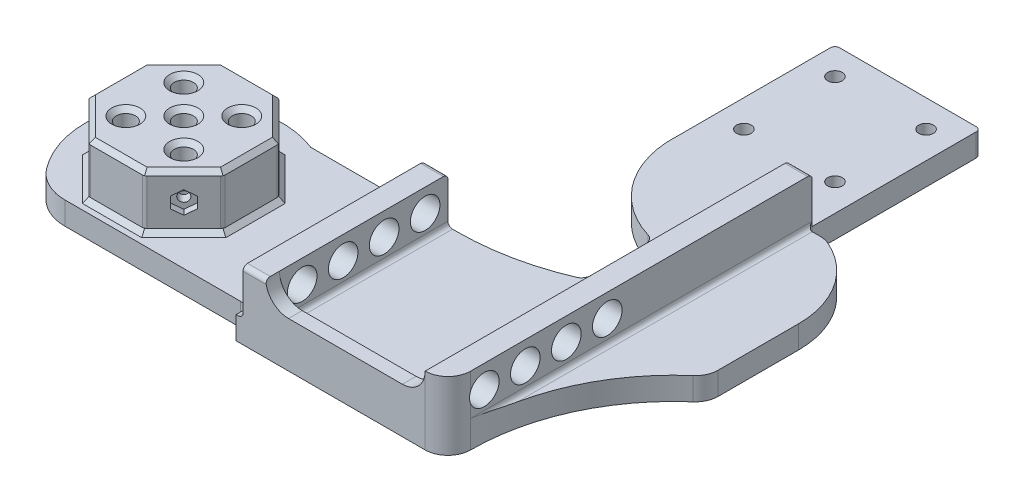
from build123d import *
from build123d.topology import SkipClean

# Parameters (mm, degrees)
SKETCH_2_W                = 32
SKETCH_2_H                = 88
EXTRUDE_1_DEPTH           = 5
SKETCH_9_W                = 100
SKETCH_9_H                = 40
EXTRUDE_6_DEPTH           = 5
SKETCH_11_R               = 2.1
CUT_EXTRUDE_3_DEPTH       = 5
SKETCH_12_R               = 21.5
SKETCH_12_R_2             = 19.5
EXTRUDE_7_DEPTH           = 8
SKETCH_13_R               = 1.6
CUT_EXTRUDE_4_DEPTH       = 112.968745639
SKETCH1_W                 = 32
SKETCH1_H                 = 5
CUT_EXTRUDE1_DEPTH        = 1
CUT_EXTRUDE_5_DEPTH       = 111.711336366
EXTRUDE_START             = 5
EXTRUDE_8_DEPTH           = 5
SKETCH_16_W               = 5
SKETCH_16_H               = 40
SKETCH_16_H_2             = 80
EXTRUDE_9_DEPTH           = 10
SKETCH_17_W               = 35
SKETCH_17_H               = 3
EXTRUDE_10_DEPTH          = 5
SKETCH_18_R               = 3.25
CUT_EXTRUDE_6_DEPTH       = 107.462434689
FILLET_5_R                = 1
FILLET_6_R                = 5
FILLET_7_R                = 1
FILLET_8_R                = 1
CUT_EXTRUDE_START         = -8
SKETCH_20_R               = 21.5
CUT_EXTRUDE_8_DEPTH       = 8
CUT_EXTRUDE_9_DEPTH       = 111.56785248
FILLET_9_R                = 10
SKETCH_22_W               = 40
SKETCH_22_H               = 5
CUT_EXTRUDE_10_DEPTH      = 17
SKETCH_23_W               = 40
SKETCH_23_H               = 5
EXTRUDE_11_DEPTH          = 17
EXTRUDE_12_DEPTH          = 5
FILLET_10_R               = 2
CUT_EXTRUDE_11_DEPTH      = 111.56785248
EXTRUDE_13_DEPTH          = 5
FILLET_12_R               = 5
FILLET_START              = -42.2945
FILLET_13_DEPTH           = 60
FILLET_START_2            = -50.0000001
FILLET_13_2_DEPTH         = 7.7055001
FILLET_START_3            = 17.7055
FILLET_13_3_DEPTH         = 7.2945
FILLET_START_4            = 5
FILLET_13_4_DEPTH         = 2
SKETCH_28_R               = 3.25
CUT_EXTRUDE_12_DEPTH      = 5
FILLET_14_R               = 5
SKETCH_29_W               = 5
SKETCH_29_H               = 8
CUT_EXTRUDE_13_DEPTH      = 1
FILLET_15_R               = 1
FILLET_16_R               = 5
EXTRUDE_START_2           = 12
SKETCH_33_R               = 2.1
EXTRUDE_15_DEPTH          = 12
CUT_EXTRUDE_15_REACH      = 102.944
CUT_EXTRUDE_15_END_RADIUS = 2.1
SKETCH_37_R               = 1.1
CUT_EXTRUDE_16_DEPTH      = 1.6
CUT_EXTRUDE_17_REACH      = 155.836
CUT_EXTRUDE_17_END_RADIUS = 2.1
SKETCH_39_R               = 1.1
CUT_EXTRUDE_18_DEPTH      = 1.6
CUT_EXTRUDE_19_REACH      = 143.078
CUT_EXTRUDE_19_END_RADIUS = 2.1
SKETCH_42_R               = 1.1
CUT_EXTRUDE_20_DEPTH      = 1.6
CUT_EXTRUDE_21_REACH      = 100.564
CUT_EXTRUDE_21_END_RADIUS = 2.1
SKETCH_44_R               = 1.1
CUT_EXTRUDE_22_DEPTH      = 1.6
CUT_EXTRUDE_23_REACH      = 127.122
CUT_EXTRUDE_23_END_RADIUS = 2.1
SKETCH_46_R               = 1.1
CUT_EXTRUDE_24_DEPTH      = 1.6
CHAMFER_1_SIZE            = 1
CHAMFER_2_SIZE            = 1
FILLET_17_R               = 1


with BuildPart() as part:
    # Эскиз2 → Бобышка-Вытянуть1 (new body)
    with BuildSketch(Plane(origin=(0, 0, 0), x_dir=(1, 0, 0), z_dir=(0, 1, 0))):
        with Locations((16, 44)):
            Rectangle(SKETCH_2_W, SKETCH_2_H)
    extrude(amount=EXTRUDE_1_DEPTH)

    # Эскиз9 → Бобышка-Вытянуть6 (add)
    with BuildSketch(Plane(origin=(0, 5, 0), x_dir=(1, 0, 0), z_dir=(0, 1, 0))):
        with Locations((-18, -10)):
            Rectangle(SKETCH_9_W, SKETCH_9_H)
    extrude(amount=-EXTRUDE_6_DEPTH)

    # Эскиз11 → Вырез-Вытянуть3 (cut)
    with BuildSketch(Plane(origin=(0, 5, 0), x_dir=(1, 0, 0), z_dir=(0, 1, 0))):
        with Locations(Location((-52.363961031, -3.636038969, 0), (0, 0, 270))):
            Circle(SKETCH_11_R)
        with Locations(Location((-39.636038969, -3.636038969, 0), (0, 0, 270))):
            Circle(SKETCH_11_R)
        with Locations(Location((-39.636038969, -16.363961031, 0), (0, 0, 270))):
            Circle(SKETCH_11_R)
        with Locations(Location((-52.363961031, -16.363961031, 0), (0, 0, 270))):
            Circle(SKETCH_11_R)
        with Locations(Location((-46, -10, 0), (0, 0, 270))):
            Circle(SKETCH_11_R)
    extrude(amount=-CUT_EXTRUDE_3_DEPTH, mode=Mode.SUBTRACT)

    # Эскиз12 → Бобышка-Вытянуть7 (add)
    with BuildSketch(Plane.XZ):
        with Locations(Location((-46, 10, 0), (0, 0, 68.471095594))):
            Circle(SKETCH_12_R)
        with Locations(Location((-46, 10, 0), (0, 0, 270))):
            Circle(SKETCH_12_R_2, mode=Mode.SUBTRACT)
    extrude(amount=EXTRUDE_7_DEPTH)

    # Эскиз13 → Вырез-Вытянуть4 (cut, through all)
    with BuildSketch(Plane(origin=(0, 5, 0), x_dir=(1, 0, 0), z_dir=(0, 1, 0))):
        with Locations(Location((6, 81, 0), (0, 0, 270))):
            Circle(SKETCH_13_R)
        with Locations(Location((6, 61, 0), (0, 0, 270))):
            Circle(SKETCH_13_R)
        with Locations(Location((26, 61, 0), (0, 0, 270))):
            Circle(SKETCH_13_R)
        with Locations(Location((26, 81, 0), (0, 0, 270))):
            Circle(SKETCH_13_R)
    extrude(amount=-CUT_EXTRUDE_4_DEPTH, mode=Mode.SUBTRACT)

    # Sketch1 → Cut-Extrude1 (cut)
    with BuildSketch(Plane(origin=(0, 0, -88), x_dir=(-1, 0, 0), z_dir=(0, 0, -1))):
        with Locations((-16, 2.5)):
            Rectangle(SKETCH1_W, SKETCH1_H)
    extrude(amount=-CUT_EXTRUDE1_DEPTH, mode=Mode.SUBTRACT)

    # Эскиз14 → Вырез-Вытянуть5 (cut, through all)
    with BuildSketch(Plane.XZ):
        with BuildLine():
            Line((-53.889866919, 30), (-68, 30))
            Line((-68, 30), (-68, -10))
            Line((-68, -10), (-53.889866919, -10))
            ThreePointArc((-53.889866919, -10), (-67.5, 10), (-53.889866919, 30))
        make_face()
    extrude(amount=-CUT_EXTRUDE_5_DEPTH, mode=Mode.SUBTRACT)

    # Эскиз15 → Бобышка-Вытянуть8 (add)
    with SkipClean():  # the faces are left unmerged after this step: merging them gives an invalid solid
        with BuildSketch(Plane(origin=(0, 0, 0), x_dir=(1, 0, 0), z_dir=(0, 1, 0)).offset(EXTRUDE_START)):
            with BuildLine():
                Line((-38.110133081, -30), (-53.889866919, -30))
                ThreePointArc((-53.889866919, -30), (-46, -31.5), (-38.110133081, -30))
            make_face()
            with BuildLine():
                Line((-53.889866919, 10), (-38.110133081, 10))
                ThreePointArc((-38.110133081, 10), (-46, 11.5), (-53.889866919, 10))
            make_face()
        extrude(amount=-EXTRUDE_8_DEPTH)

    # Эскиз16 → Бобышка-Вытянуть9 (add)
    with SkipClean():  # the faces are left unmerged after this step: merging them gives an invalid solid
        with BuildSketch(Plane(origin=(0, 5, 0), x_dir=(1, 0, 0), z_dir=(0, 1, 0))):
            with Locations((-10.5, -10)):
                Rectangle(SKETCH_16_W, SKETCH_16_H)
            with Locations((29.5, 10)):
                Rectangle(SKETCH_16_W, SKETCH_16_H_2)
        extrude(amount=EXTRUDE_9_DEPTH)

    # Эскиз17 → Бобышка-Вытянуть10 (add)
    with SkipClean():  # the faces are left unmerged after this step: merging them gives an invalid solid
        with BuildSketch(Plane(origin=(0, 5, 0), x_dir=(1, 0, 0), z_dir=(0, 1, 0))):
            with Locations((9.5, -28.5)):
                Rectangle(SKETCH_17_W, SKETCH_17_H)
        extrude(amount=EXTRUDE_10_DEPTH)

    # Эскиз18 → Вырез-Вытянуть6 (cut, through all)
    with SkipClean():  # the faces are left unmerged after this step: merging them gives an invalid solid
        with BuildSketch(Plane(origin=(-8, 0, 0), x_dir=(0, 0, -1), z_dir=(1, 0, 0))):
            with Locations((5, 10)):
                Circle(SKETCH_18_R)
            with Locations((-4, 10)):
                Circle(SKETCH_18_R)
            with Locations((-13, 10)):
                Circle(SKETCH_18_R)
            with Locations((-22, 10)):
                Circle(SKETCH_18_R)
        extrude(amount=-CUT_EXTRUDE_6_DEPTH, mode=Mode.SUBTRACT)

    # Скругление5
    fillet_5_edges = [part.edges().sort_by_distance(p)[0] for p in [
        (-13, 5, 10),
        (27, 5, -11.5),
        (9.5, 5, 27),
        (-8, 5, 8.5),
    ]]
    fillet(fillet_5_edges, radius=FILLET_5_R)

    # Скругление6
    fillet_6_edges = [part.edges().sort_by_distance(p)[0] for p in [
        (27, 10, 28.5),
        (-8, 10, 28.5),
    ]]
    fillet(fillet_6_edges, radius=FILLET_6_R - 0.0001)  # a hair under: the kernel refuses the full size

    # Скругление7
    fillet_7_edges = [part.edges().sort_by_distance(p)[0] for p in [
        (32, 2.5, -87),
        (0, 2.5, -87),
    ]]
    fillet(fillet_7_edges, radius=FILLET_7_R)

    # Скругление8
    fillet_8_edges = [part.edges().sort_by_distance(p)[0] for p in [
        (-10.5, 15, 30),
        (-10.5, 15, -10),
        (29.5, 15, -50),
    ]]
    fillet(fillet_8_edges, radius=FILLET_8_R)

    # Эскиз20 → Вырез-Вытянуть8 (cut)
    with BuildSketch(Plane.XZ.offset(8).offset(CUT_EXTRUDE_START)):
        with Locations((-46, 10)):
            Circle(SKETCH_20_R)
    extrude(amount=CUT_EXTRUDE_8_DEPTH, mode=Mode.SUBTRACT)

    # Эскиз21 → Вырез-Вытянуть9 (cut, through all)
    with BuildSketch(Plane(origin=(0, 5, 0), x_dir=(1, 0, 0), z_dir=(0, 1, 0))):
        with BuildLine():
            Line((-59.162446581, -27), (-16.5, -27))
            ThreePointArc((-16.5, -27), (-15.085786438, -27.585786438), (-14.5, -29))
            Line((-14.5, -29), (-14.5, -30))
            Line((-14.5, -30), (-38.110133081, -30))
            ThreePointArc((-38.110133081, -30), (-49.033154146, -31.284970658), (-59.162446581, -27))
        make_face()
    extrude(amount=-CUT_EXTRUDE_9_DEPTH, mode=Mode.SUBTRACT)

    # Скругление9
    fillet_9_edges = [part.edges().sort_by_distance(p)[0] for p in [
        (-59.162446581, 2.5, 27),
    ]]
    fillet(fillet_9_edges, radius=FILLET_9_R)

    # Эскиз22 → Вырез-Вытянуть10 (cut)
    with BuildSketch(Plane.ZY):
        with Locations((-30, 2.5)):
            Rectangle(SKETCH_22_W, SKETCH_22_H)
    extrude(amount=-CUT_EXTRUDE_10_DEPTH, mode=Mode.SUBTRACT)

    # Эскиз23 → Бобышка-Вытянуть11 (add)
    with BuildSketch(Plane(origin=(32, 0, 0), x_dir=(0, 0, -1), z_dir=(1, 0, 0))):
        with Locations((30, 2.5)):
            Rectangle(SKETCH_23_W, SKETCH_23_H)
    extrude(amount=EXTRUDE_11_DEPTH)

    # Эскиз25 → Бобышка-Вытянуть12 (add)
    with BuildSketch(Plane(origin=(0, 5, 0), x_dir=(1, 0, 0), z_dir=(0, 1, 0))):
        with BuildLine():
            Line((17, 15), (17, 10))
            Line((17, 10), (-6, 10))
            ThreePointArc((-6, 10), (5.768602296, 11.264429439), (17, 15))
        make_face()
        with BuildLine():
            Line((17, 30), (17, 50))
            Line((17, 50), (0, 50))
            ThreePointArc((0, 50), (5.190473587, 37.186902549), (17, 30))
        make_face()
    extrude(amount=-EXTRUDE_12_DEPTH)

    # Скругление10
    fillet_10_edges = [part.edges().sort_by_distance(p)[0] for p in [
        (17, 2.5, -15),
        (17, 2.5, -30),
    ]]
    fillet(fillet_10_edges, radius=FILLET_10_R)

    # Эскиз26 → Вырез-Вытянуть11 (cut, through all)
    with BuildSketch(Plane(origin=(0, 5, 0), x_dir=(1, 0, 0), z_dir=(0, 1, 0))):
        with BuildLine():
            Line((49, 50), (32, 50))
            ThreePointArc((32, 50), (44.175770292, 43.124404748), (49, 30))
            Line((49, 30), (49, 50))
        make_face()
    extrude(amount=-CUT_EXTRUDE_11_DEPTH, mode=Mode.SUBTRACT)

    # Эскиз27 → Бобышка-Вытянуть13 (add)
    with BuildSketch(Plane(origin=(0, 5, 0), x_dir=(1, 0, 0), z_dir=(0, 1, 0))):
        with BuildLine():
            Line((49, 10), (32, 10))
            Line((32, 10), (32, -25))
            ThreePointArc((32, -25), (36.474842586, -5.544923542), (49, 10))
        make_face()
    extrude(amount=-EXTRUDE_13_DEPTH)

    # Скругление12
    fillet_12_edges = [part.edges().sort_by_distance(p)[0] for p in [
        (32, 7.5, 30),
    ]]
    fillet(fillet_12_edges, radius=FILLET_12_R - 0.0001)  # a hair under: the kernel refuses the full size

    # Скругление13: read off the stored shape, not the designer's step
    # Скругление13 outline → Скругление13 (add)
    with BuildSketch(Plane.XY.offset(FILLET_START)):
        with BuildLine():
            Line((32, 5), (33, 5))
            ThreePointArc((33, 5), (32.292893219, 5.292893219), (32, 6))
            Line((32, 6), (32, 5))
        make_face()
    extrude(amount=FILLET_13_DEPTH)

    # Fillet 13 2 outline → Fillet 13 2 (add)
    with BuildSketch(Plane.XY.offset(FILLET_START_2)):
        with BuildLine():
            Line((32, 5), (33, 5))
            ThreePointArc((33, 5), (32.292893219, 5.292893219), (32, 6))
            Line((32, 6), (32, 5))
        make_face()
    extrude(amount=FILLET_13_2_DEPTH)

    # Fillet 13 3 outline → Fillet 13 3 (add)
    with BuildSketch(Plane.XY.offset(FILLET_START_3)):
        with BuildLine():
            Line((32, 5), (33, 5))
            ThreePointArc((33, 5), (32.292893219, 5.292893219), (32, 6))
            Line((32, 6), (32, 5))
        make_face()
    extrude(amount=FILLET_13_3_DEPTH)

    # Fillet 13 4 outline → Fillet 13 4 (cut)
    with BuildSketch(Plane(origin=(0, 0, 0), x_dir=(1, 0, 0), z_dir=(0, 1, 0)).offset(FILLET_START_4)):
        with BuildLine():
            Line((33, 50.0000001), (32, 50))
            ThreePointArc((32, 50), (32.501187488, 49.91171393), (33, 49.810870456))
            Line((33, 49.810870456), (33, 50.0000001))
        make_face()
        with BuildLine():
            Line((32, -25), (33, -25))
            Line((33, -25), (33, -15.616033699))
            ThreePointArc((33, -15.616033699), (32.250705751, -20.281450871), (32, -25))
        make_face()
    extrude(amount=FILLET_13_4_DEPTH, mode=Mode.SUBTRACT)

    # Эскиз28 → Вырез-Вытянуть12 (cut)
    with BuildSketch(Plane(origin=(32, 0, 0), x_dir=(0, 0, -1), z_dir=(1, 0, 0))):
        with Locations((5, 10)):
            Circle(SKETCH_28_R)
        with Locations((-4, 10)):
            Circle(SKETCH_28_R)
        with Locations((-13, 10)):
            Circle(SKETCH_28_R)
        with Locations((-22, 10)):
            Circle(SKETCH_28_R)
    extrude(amount=-CUT_EXTRUDE_12_DEPTH, mode=Mode.SUBTRACT)

    # Скругление14
    fillet_14_edges = [part.edges().sort_by_distance(p)[0] for p in [
        (49, 2.5, -10),
    ]]
    fillet(fillet_14_edges, radius=FILLET_14_R)

    # Эскиз29 → Вырез-Вытянуть13 (cut)
    with BuildSketch(Plane(origin=(0, 0, -50), x_dir=(-1, 0, 0), z_dir=(0, 0, -1))):
        with Locations((-34.5, 4)):
            Rectangle(SKETCH_29_W, SKETCH_29_H)
    extrude(amount=-CUT_EXTRUDE_13_DEPTH, mode=Mode.SUBTRACT)

    # Скругление15
    fillet_15_edges = [part.edges().sort_by_distance(p)[0] for p in [
        (32, 3, -49),
    ]]
    fillet(fillet_15_edges, radius=FILLET_15_R - 0.0001)  # a hair under: the kernel refuses the full size

    # Скругление16
    fillet_16_edges = [part.edges().sort_by_distance(p)[0] for p in [
        (35.782158988, 2.5, -49),
    ]]
    fillet(fillet_16_edges, radius=FILLET_16_R)

    # Эскиз33 → Бобышка-Вытянуть15 (add)
    with BuildSketch(Plane(origin=(0, 5, 0), x_dir=(1, 0, 0), z_dir=(0, 1, 0)).offset(EXTRUDE_START_2)):
        Polygon((-52.109650045, -24.75), (-39.890349955, -24.75), (-31.25, -16.109650045), (-31.25, -3.890349955), (-39.890349955, 4.75), (-52.109650045, 4.75), (-60.75, -3.890349955), (-60.75, -16.109650045), align=None)
        with Locations(Location((-52.363961031, -3.636038969, 0), (0, 0, 270))):
            Circle(SKETCH_33_R, mode=Mode.SUBTRACT)
        with Locations(Location((-46, -10, 0), (0, 0, 270))):
            Circle(SKETCH_33_R, mode=Mode.SUBTRACT)
        with Locations(Location((-52.363961031, -16.363961031, 0), (0, 0, 270))):
            Circle(SKETCH_33_R, mode=Mode.SUBTRACT)
        with Locations(Location((-39.636038969, -3.636038969, 0), (0, 0, 270))):
            Circle(SKETCH_33_R, mode=Mode.SUBTRACT)
        with Locations(Location((-39.636038969, -16.363961031, 0), (0, 0, 270))):
            Circle(SKETCH_33_R, mode=Mode.SUBTRACT)
    extrude(amount=-EXTRUDE_15_DEPTH)

    # Вырез-Вытянуть15: up to this cylinder (the profile starts outside it)
    cut_extrude_15_end = Plane(origin=(-39.636038969, 11, 16.363961031), z_dir=(0, 1, 0)) * Cylinder(CUT_EXTRUDE_15_END_RADIUS, 211.088, mode=Mode.PRIVATE)
    # Эскиз37 → Вырез-Вытянуть15 (cut, up to the surface)
    with BuildSketch(Plane(origin=(-7.570174977, 0, -7.570174977), x_dir=(0.7071067811865475, 0, -0.7071067811865477), z_dir=(0.7071067811865477, 0, 0.7071067811865475)), mode=Mode.PRIVATE) as cut_extrude_15_sk1:
        with Locations((-39.597979746, 11)):
            Circle(SKETCH_37_R)
    cut_extrude_15_tool1 = extrude(cut_extrude_15_sk1.sketch, amount=-CUT_EXTRUDE_15_REACH, mode=Mode.PRIVATE) - cut_extrude_15_end
    add(cut_extrude_15_tool1.solids().sort_by_distance((-35.570175, 11, 20.429825))[0], mode=Mode.SUBTRACT)

    # Эскиз38 → Вырез-Вытянуть16 (cut)
    with BuildSketch(Plane(origin=(-7.570174977, 0, -7.570174977), x_dir=(0.7071067811865475, 0, -0.7071067811865477), z_dir=(0.7071067811865477, 0, 0.7071067811865475))):
        Polygon((-39.597979746, 8.575128869), (-37.497979746, 9.787564435), (-37.497979746, 12.212435565), (-39.597979746, 13.424871131), (-41.697979746, 12.212435565), (-41.697979746, 9.787564435), align=None)
    extrude(amount=-CUT_EXTRUDE_16_DEPTH, mode=Mode.SUBTRACT)

    # Вырез-Вытянуть17: up to this cylinder (the profile starts outside it)
    cut_extrude_17_end = Plane(origin=(-52.363961031, 11, 16.363961031), z_dir=(0, 1, 0)) * Cylinder(CUT_EXTRUDE_17_END_RADIUS, 316.872, mode=Mode.PRIVATE)
    # Эскиз39 → Вырез-Вытянуть17 (cut, up to the surface)
    with BuildSketch(Plane(origin=(-38.429825023, 0, 38.429825023), x_dir=(0.7071067811865476, 0, 0.7071067811865476), z_dir=(-0.7071067811865476, 0, 0.7071067811865476)), mode=Mode.PRIVATE) as cut_extrude_17_sk1:
        with Locations((-25.455844123, 11)):
            Circle(SKETCH_39_R)
    cut_extrude_17_tool1 = extrude(cut_extrude_17_sk1.sketch, amount=-CUT_EXTRUDE_17_REACH, mode=Mode.PRIVATE) - cut_extrude_17_end
    add(cut_extrude_17_tool1.solids().sort_by_distance((-56.429825, 11, 20.429825))[0], mode=Mode.SUBTRACT)

    # Эскиз41 → Вырез-Вытянуть18 (cut)
    with BuildSketch(Plane(origin=(-38.429825023, 0, 38.429825023), x_dir=(0.7071067811865476, 0, 0.7071067811865476), z_dir=(-0.7071067811865476, 0, 0.7071067811865476))):
        Polygon((-25.455844123, 8.575128869), (-23.355844123, 9.787564435), (-23.355844123, 12.212435565), (-25.455844123, 13.424871131), (-27.555844123, 12.212435565), (-27.555844123, 9.787564435), align=None)
    extrude(amount=-CUT_EXTRUDE_18_DEPTH, mode=Mode.SUBTRACT)

    # Вырез-Вытянуть19: up to this cylinder (the profile starts outside it)
    cut_extrude_19_end = Plane(origin=(-46, 11, 10), z_dir=(0, 1, 0)) * Cylinder(CUT_EXTRUDE_19_END_RADIUS, 291.356, mode=Mode.PRIVATE)
    # Эскиз42 → Вырез-Вытянуть19 (cut, up to the surface)
    with BuildSketch(Plane.ZY.offset(60.75), mode=Mode.PRIVATE) as cut_extrude_19_sk1:
        with Locations((10, 11)):
            Circle(SKETCH_42_R)
    cut_extrude_19_tool1 = extrude(cut_extrude_19_sk1.sketch, amount=-CUT_EXTRUDE_19_REACH, mode=Mode.PRIVATE) - cut_extrude_19_end
    add(cut_extrude_19_tool1.solids().sort_by_distance((-60.75, 11, 10))[0], mode=Mode.SUBTRACT)

    # Эскиз43 → Вырез-Вытянуть20 (cut)
    with BuildSketch(Plane.ZY.offset(60.75)):
        Polygon((10, 13.424871131), (7.9, 12.212435565), (7.9, 9.787564435), (10, 8.575128869), (12.1, 9.787564435), (12.1, 12.212435565), align=None)
    extrude(amount=-CUT_EXTRUDE_20_DEPTH, mode=Mode.SUBTRACT)

    # Вырез-Вытянуть21: up to this cylinder (the profile starts outside it)
    cut_extrude_21_end = Plane(origin=(-52.363961031, 11, 3.636038969), z_dir=(0, 1, 0)) * Cylinder(CUT_EXTRUDE_21_END_RADIUS, 206.328, mode=Mode.PRIVATE)
    # Эскиз44 → Вырез-Вытянуть21 (cut, up to the surface)
    with BuildSketch(Plane(origin=(-28.429825023, 0, -28.429825023), x_dir=(-0.7071067811865475, 0, 0.7071067811865477), z_dir=(-0.7071067811865477, 0, -0.7071067811865475)), mode=Mode.PRIVATE) as cut_extrude_21_sk1:
        with Locations(Location((39.597979746, 11, 0), (0, 0, 180))):
            Circle(SKETCH_44_R)
    cut_extrude_21_tool1 = extrude(cut_extrude_21_sk1.sketch, amount=-CUT_EXTRUDE_21_REACH, mode=Mode.PRIVATE) - cut_extrude_21_end
    add(cut_extrude_21_tool1.solids().sort_by_distance((-56.429825, 11, -0.429825))[0], mode=Mode.SUBTRACT)

    # Эскиз45 → Вырез-Вытянуть22 (cut)
    with BuildSketch(Plane(origin=(-28.429825023, 0, -28.429825023), x_dir=(-0.7071067811865475, 0, 0.7071067811865477), z_dir=(-0.7071067811865477, 0, -0.7071067811865475))):
        Polygon((39.597979746, 13.424871131), (37.497979746, 12.212435565), (37.497979746, 9.787564435), (39.597979746, 8.575128869), (41.697979746, 9.787564435), (41.697979746, 12.212435565), align=None)
    extrude(amount=-CUT_EXTRUDE_22_DEPTH, mode=Mode.SUBTRACT)

    # Вырез-Вытянуть23: up to this cylinder (the profile starts outside it)
    cut_extrude_23_end = Plane(origin=(-39.636038969, 11, 3.636038969), z_dir=(0, 1, 0)) * Cylinder(CUT_EXTRUDE_23_END_RADIUS, 259.444, mode=Mode.PRIVATE)
    # Эскиз46 → Вырез-Вытянуть23 (cut, up to the surface)
    with BuildSketch(Plane(origin=(-17.570174977, 0, 17.570174977), x_dir=(-0.7071067811865476, 0, -0.7071067811865476), z_dir=(0.7071067811865476, 0, -0.7071067811865476)), mode=Mode.PRIVATE) as cut_extrude_23_sk1:
        with Locations(Location((25.455844123, 11, 0), (0, 0, 180))):
            Circle(SKETCH_46_R)
    cut_extrude_23_tool1 = extrude(cut_extrude_23_sk1.sketch, amount=-CUT_EXTRUDE_23_REACH, mode=Mode.PRIVATE) - cut_extrude_23_end
    add(cut_extrude_23_tool1.solids().sort_by_distance((-35.570175, 11, -0.429825))[0], mode=Mode.SUBTRACT)

    # Эскиз47 → Вырез-Вытянуть24 (cut)
    with BuildSketch(Plane(origin=(-17.570174977, 0, 17.570174977), x_dir=(-0.7071067811865476, 0, -0.7071067811865476), z_dir=(0.7071067811865476, 0, -0.7071067811865476))):
        Polygon((25.455844123, 13.424871131), (23.355844123, 12.212435565), (23.355844123, 9.787564435), (25.455844123, 8.575128869), (27.555844123, 9.787564435), (27.555844123, 12.212435565), align=None)
    extrude(amount=-CUT_EXTRUDE_24_DEPTH, mode=Mode.SUBTRACT)

    # Фаска1
    chamfer_1_edges = [part.edges().sort_by_distance(p)[0] for p in [
        (-56.429825023, 5, 20.429825023),
        (-46, 5, 24.75),
        (-35.570174977, 5, 20.429825023),
        (-31.25, 5, 10),
        (-35.570174977, 5, -0.429825023),
        (-46, 5, -4.75),
        (-56.429825023, 5, -0.429825023),
        (-60.75, 5, 10),
    ]]
    chamfer(chamfer_1_edges, length=CHAMFER_1_SIZE)

    # Фаска2
    chamfer_2_edges = [part.edges().sort_by_distance(p)[0] for p in [
        (-56.429825023, 17, 20.429825023),
        (-46, 17, 24.75),
        (-35.570174977, 17, 20.429825023),
        (-31.25, 17, 10),
        (-35.570174977, 17, -0.429825023),
        (-46, 17, -4.75),
        (-56.429825023, 17, -0.429825023),
        (-60.75, 17, 10),
        (-52.363961031, 17, 1.536038969),
        (-46, 17, 7.9),
        (-52.363961031, 17, 14.263961031),
        (-39.636038969, 17, 1.536038969),
        (-39.636038969, 17, 14.263961031),
    ]]
    chamfer(chamfer_2_edges, length=CHAMFER_2_SIZE)

    # Скругление17
    fillet_17_edges = [part.edges().sort_by_distance(p)[0] for p in [
        (-60.75, 11, 3.890349955),
        (-60.75, 11, 16.109650045),
        (-52.109650045, 11, -4.75),
        (-39.890349955, 11, -4.75),
        (-31.25, 11, 3.890349955),
        (-31.25, 11, 16.109650045),
        (-39.890349955, 11, 24.75),
        (-52.109650045, 11, 24.75),
    ]]
    fillet(fillet_17_edges, radius=FILLET_17_R)


solid = part.part
